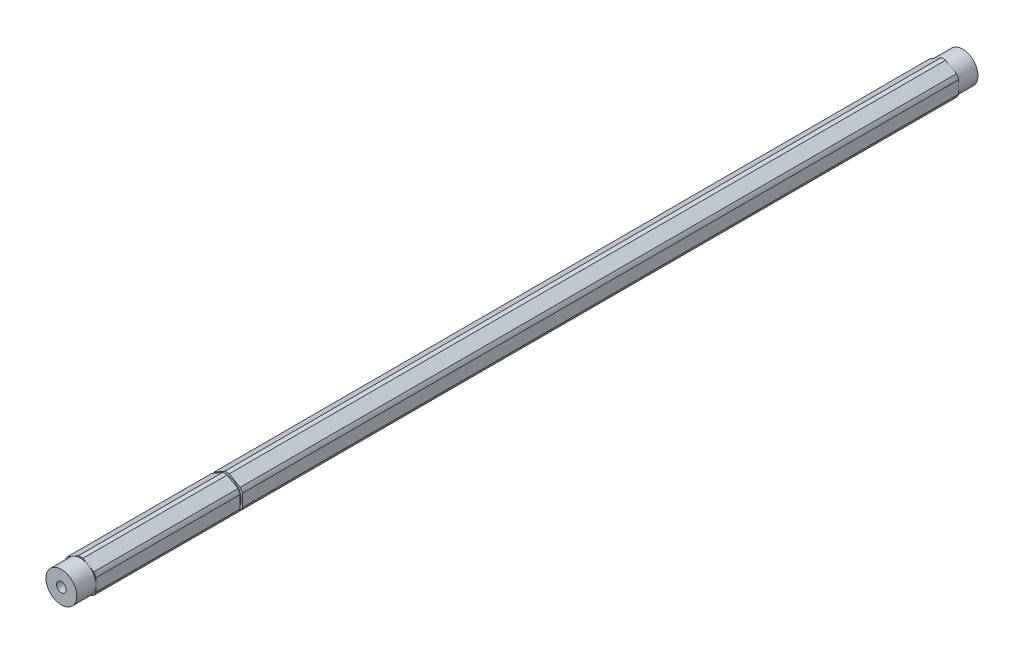
from build123d import *

# Parameters (mm, degrees)
SKETCH1_R           = 2.000000064
BOSS_EXTRUDE1_DEPTH = 177.8
SKETCH3_R           = 6.35
SKETCH3_R_2         = 2.000000064
BOSS_EXTRUDE3_DEPTH = 7.9375
SKETCH5_W           = 0.889
SKETCH5_H           = 1.0033


with BuildPart() as part:
    # Sketch1 → Boss-Extrude1 (new, symmetric)
    with BuildSketch(Plane.XY):
        with BuildLine():
            ThreePointArc((0.93173274, 6.79441227), (0, 6.858), (-0.93173274, 6.79441227))
            Line((-0.93173274, 6.79441227), (-5.41826726, 4.204110358))
            ThreePointArc((-5.41826726, 4.204110358), (-5.939202219, 3.429), (-6.35, 2.590301913))
            Line((-6.35, 2.590301913), (-6.35, -2.590301913))
            ThreePointArc((-6.35, -2.590301913), (-5.939202219, -3.429), (-5.41826726, -4.204110358))
            Line((-5.41826726, -4.204110358), (-0.93173274, -6.79441227))
            ThreePointArc((-0.93173274, -6.79441227), (0, -6.858), (0.93173274, -6.79441227))
            Line((0.93173274, -6.79441227), (5.41826726, -4.204110358))
            ThreePointArc((5.41826726, -4.204110358), (5.939202219, -3.429), (6.35, -2.590301913))
            Line((6.35, -2.590301913), (6.35, 2.590301913))
            ThreePointArc((6.35, 2.590301913), (5.939202219, 3.429), (5.41826726, 4.204110358))
            Line((5.41826726, 4.204110358), (0.93173274, 6.79441227))
        make_face()
        Circle(SKETCH1_R, mode=Mode.SUBTRACT)
    extrude(amount=BOSS_EXTRUDE1_DEPTH, both=True)

    # Sketch3 → Boss-Extrude3 (add)
    with BuildSketch(Plane.XY.offset(177.8)):
        Circle(SKETCH3_R)
        Circle(SKETCH3_R_2, mode=Mode.SUBTRACT)
    boss_extrude3 = extrude(amount=BOSS_EXTRUDE3_DEPTH)

    # Mirror1: Boss-Extrude3 across plane
    add(boss_extrude3.mirror(Plane.XY))

    # Sketch5 → Cut-Revolve1 (revolve, cut)
    with BuildSketch(Plane(origin=(0, 0, 0), x_dir=(0, 0, -1), z_dir=(1, 0, 0))):
        with Locations((-117.9195, 6.35635)):
            Rectangle(SKETCH5_W, SKETCH5_H)
    revolve(axis=Axis((0, 0, 0), (0, 0, -1)), mode=Mode.SUBTRACT)


solid = part.part
